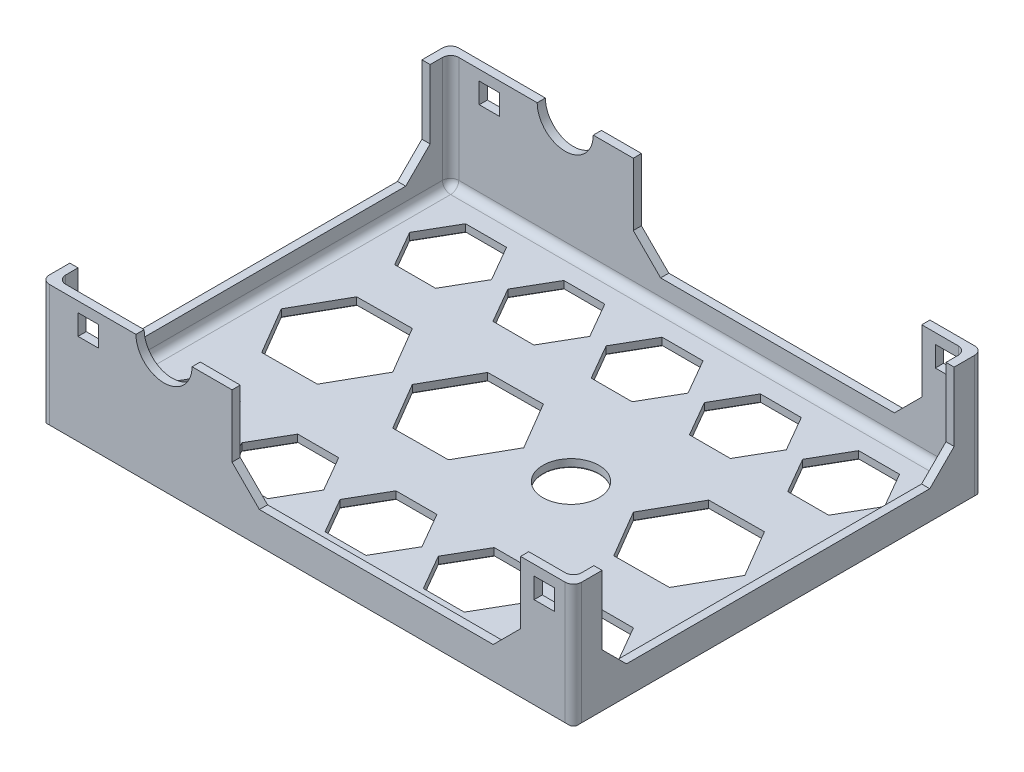
from build123d import *

# Parameters (mm, degrees)
SKETCH1_W            = 130
SKETCH1_H            = 100
BOSS_EXTRUDE1_DEPTH  = 30
SHELL1_T             = -2
CHAMFER1_SIZE        = 0.25
SKETCH2_R            = 6.85
CUT_EXTRUDE1_DEPTH   = 123.983738762
SKETCH3_R            = 6.85
CUT_EXTRUDE2_DEPTH   = 60
CUT_EXTRUDE3_DEPTH   = 123.983738762
CUT_EXTRUDE4_DEPTH   = 143.478068488
CUT_EXTRUDE5_DEPTH   = 87.654486324
LPATTERN1_COUNT      = 5
LPATTERN1_PITCH      = 24
LPATTERN1_COUNT_DIR2 = 2
LPATTERN1_PITCH_DIR2 = 65
CUT_EXTRUDE6_DEPTH   = 87.654486324
LPATTERN2_COUNT      = 2
LPATTERN2_PITCH      = 32
LPATTERN3_COUNT      = 2
LPATTERN3_PITCH      = 86
FILLET1_R            = 2
CHAMFER2_SIZE        = 0.25
FILLET2_R            = 0.25
SKETCH9_W            = 5
SKETCH9_H            = 5
CUT_EXTRUDE7_DEPTH   = 123.983738762
SKETCH10_W           = 5
SKETCH10_H           = 5
CUT_EXTRUDE8_DEPTH   = 123.983738762


with BuildPart() as part:
    # Sketch1 → Boss-Extrude1 (new body)
    with BuildSketch(Plane(origin=(0, 0, 0), x_dir=(1, 0, 0), z_dir=(0, 1, 0))):
        Rectangle(SKETCH1_W, SKETCH1_H)
    extrude(amount=BOSS_EXTRUDE1_DEPTH)

    # Shell1
    shell1_openings = [part.faces().sort_by_distance(p)[0] for p in [
        (0, 30, 0),
    ]]
    offset(amount=SHELL1_T, openings=shell1_openings, kind=Kind.INTERSECTION)

    # Chamfer1
    chamfer1_edges = [part.edges().sort_by_distance(p)[0] for p in [
        (0, 0, 50),
        (-65, 0, 0),
        (0, 0, -50),
        (65, 0, 0),
    ]]
    chamfer(chamfer1_edges, length=CHAMFER1_SIZE)

    # Sketch2 → Cut-Extrude1 (cut, through all)
    with BuildSketch(Plane(origin=(0, 0, -50), x_dir=(-1, 0, 0), z_dir=(0, 0, -1))):
        with Locations((35, 30)):
            Circle(SKETCH2_R)
    extrude(amount=-CUT_EXTRUDE1_DEPTH, mode=Mode.SUBTRACT)

    # Sketch3 → Cut-Extrude2 (cut)
    with BuildSketch(Plane(origin=(0, 2, 0), x_dir=(1, 0, 0), z_dir=(0, 1, 0))):
        with Locations(Location((14.4, 0, 0), (0, 0, 270))):
            Circle(SKETCH3_R)
    extrude(amount=-CUT_EXTRUDE2_DEPTH, mode=Mode.SUBTRACT)

    # Sketch5 → Cut-Extrude3 (cut, through all)
    with BuildSketch(Plane.XY.offset(50)):
        Polygon((52.09, 30), (52.09, 14.7), (45.41, 8.02), (-11.7, 8.02), (-18.38, 14.7), (-18.38, 30), align=None)
    extrude(amount=-CUT_EXTRUDE3_DEPTH, mode=Mode.SUBTRACT)

    # Sketch6 → Cut-Extrude4 (cut, through all)
    with BuildSketch(Plane(origin=(65, 0, 0), x_dir=(0, 0, -1), z_dir=(1, 0, 0))):
        Polygon((-43, 30), (-43, 13.205562602), (-37.044437398, 7.25), (37.044437398, 7.25), (43, 13.205562602), (43, 30), align=None)
    extrude(amount=-CUT_EXTRUDE4_DEPTH, mode=Mode.SUBTRACT)

    # Sketch7 → Cut-Extrude5 (cut, through all)
    with BuildSketch(Plane(origin=(0, 2, 0), x_dir=(1, 0, 0), z_dir=(0, 1, 0))):
        Polygon((-43, 24.339745962), (-38, 33), (-43, 41.660254038), (-53, 41.660254038), (-58, 33), (-53, 24.339745962), align=None)
    cut_extrude5 = extrude(amount=-CUT_EXTRUDE5_DEPTH, mode=Mode.SUBTRACT)

    # LPattern1: Cut-Extrude5 5 × 2
    with Locations(*[(i * LPATTERN1_PITCH, 0, j * LPATTERN1_PITCH_DIR2) for i in range(LPATTERN1_COUNT) for j in range(LPATTERN1_COUNT_DIR2) if (i, j) != (0, 0)]):
        add(cut_extrude5, mode=Mode.SUBTRACT)

    # Sketch8 → Cut-Extrude6 (cut, through all)
    with BuildSketch(Plane(origin=(0, 2, 0), x_dir=(1, 0, 0), z_dir=(0, 1, 0))):
        Polygon((-37.344330278, 13.006181596), (-50.843892889, 12.8975109), (-57.499562611, 1.152211391), (-50.655669722, -10.484417422), (-37.156107111, -10.375746726), (-30.500437389, 1.369552783), align=None)
    cut_extrude6 = extrude(amount=-CUT_EXTRUDE6_DEPTH, mode=Mode.SUBTRACT)

    # LPattern2: Cut-Extrude6 ×2
    with Locations(*[(i * LPATTERN2_PITCH, 0, 0) for i in range(1, LPATTERN2_COUNT)]):
        add(cut_extrude6, mode=Mode.SUBTRACT)

    # LPattern3: Cut-Extrude6 ×2
    with Locations(*[(i * LPATTERN3_PITCH, 0, 0) for i in range(1, LPATTERN3_COUNT)]):
        add(cut_extrude6, mode=Mode.SUBTRACT)

    # Fillet1
    # the kernel refuses this fillet: 2 mm, written as the material it adds along each edge
    with BuildSketch(Plane(origin=(-61, 4, 46), x_dir=(-1, 0, 0), z_dir=(0, -1, 0))) as fillet1_piece_1_section:
        Polygon((0, 0), (FILLET1_R, 0), (FILLET1_R, -FILLET1_R), (0, -FILLET1_R), align=None)
    fillet1_piece_1 = extrude(amount=FILLET1_R, mode=Mode.PRIVATE)
    fillet1_piece_1 = fillet1_piece_1 - Plane(origin=(-61, 4, 46), x_dir=(0.7071067811865475, 0, -0.7071067811865475), z_dir=(0, -1, 0)) * Sphere(FILLET1_R, mode=Mode.PRIVATE)
    add(fillet1_piece_1)
    with BuildSketch(Plane(origin=(61, 4, 46), x_dir=(0, -1, 0), z_dir=(1, 0, 0))) as fillet1_piece_2_section:
        Polygon((0, 0), (FILLET1_R, 0), (FILLET1_R, -FILLET1_R), (0, -FILLET1_R), align=None)
    fillet1_piece_2 = extrude(amount=FILLET1_R, mode=Mode.PRIVATE)
    fillet1_piece_2 = fillet1_piece_2 - Plane(origin=(61, 4, 46), x_dir=(0, 0.7071067811865475, -0.7071067811865475), z_dir=(1, 0, 0)) * Sphere(FILLET1_R, mode=Mode.PRIVATE)
    add(fillet1_piece_2)
    with BuildSketch(Plane(origin=(61, 4, -46), x_dir=(0, -1, 0), z_dir=(1, 0, 0))) as fillet1_piece_3_section:
        Polygon((0, 0), (FILLET1_R, 0), (FILLET1_R, FILLET1_R), (0, FILLET1_R), align=None)
    fillet1_piece_3 = extrude(amount=FILLET1_R, mode=Mode.PRIVATE)
    fillet1_piece_3 = fillet1_piece_3 - Plane(origin=(61, 4, -46), x_dir=(0, 0.7071067811865475, 0.7071067811865475), z_dir=(1, 0, 0)) * Sphere(FILLET1_R, mode=Mode.PRIVATE)
    add(fillet1_piece_3)
    with BuildSketch(Plane(origin=(-61, 4, -46), x_dir=(-1, 0, 0), z_dir=(0, -1, 0))) as fillet1_piece_4_section:
        Polygon((0, 0), (FILLET1_R, 0), (FILLET1_R, FILLET1_R), (0, FILLET1_R), align=None)
    fillet1_piece_4 = extrude(amount=FILLET1_R, mode=Mode.PRIVATE)
    fillet1_piece_4 = fillet1_piece_4 - Plane(origin=(-61, 4, -46), x_dir=(0.7071067811865475, 0, 0.7071067811865475), z_dir=(0, -1, 0)) * Sphere(FILLET1_R, mode=Mode.PRIVATE)
    add(fillet1_piece_4)
    with BuildSketch(Plane(origin=(-63, 30, 48), x_dir=(1, 0, 0), z_dir=(0, -1, 0)), Plane(origin=(63, 4, 48), x_dir=(-1, 0, 0), z_dir=(0, 1, 0)), Plane(origin=(63, 4, -48), x_dir=(0, 0, 1), z_dir=(0, 1, 0))) as fillet1_piece_5:
        with BuildLine():
            CenterArc((FILLET1_R, -FILLET1_R), FILLET1_R, 90, 90)
            Line((0, -FILLET1_R), (0, 0))
            Line((0, 0), (FILLET1_R, 0))
        make_face()
    extrude(amount=26)
    with BuildSketch(Plane(origin=(-63, 4, -48), x_dir=(0, 0, 1), z_dir=(0, 1, 0))) as fillet1_piece_6:
        with BuildLine():
            CenterArc((FILLET1_R, FILLET1_R), FILLET1_R, 180, 90)
            Line((0, FILLET1_R), (0, 0))
            Line((0, 0), (FILLET1_R, 0))
        make_face()
    extrude(amount=26)
    with BuildSketch(Plane(origin=(-61, 2, 48), x_dir=(0, 1, 0), z_dir=(1, 0, 0)), Plane(origin=(61, 2, -48), x_dir=(0, 1, 0), z_dir=(-1, 0, 0))) as fillet1_piece_7:
        with BuildLine():
            CenterArc((FILLET1_R, -FILLET1_R), FILLET1_R, 90, 90)
            Line((0, -FILLET1_R), (0, 0))
            Line((0, 0), (FILLET1_R, 0))
        make_face()
    extrude(amount=122)
    with BuildSketch(Plane(origin=(-63, 2, -46), x_dir=(0, 1, 0), z_dir=(0, 0, 1)), Plane(origin=(63, 2, 46), x_dir=(0, 1, 0), z_dir=(0, 0, -1))) as fillet1_piece_8:
        with BuildLine():
            CenterArc((FILLET1_R, -FILLET1_R), FILLET1_R, 90, 90)
            Line((0, -FILLET1_R), (0, 0))
            Line((0, 0), (FILLET1_R, 0))
        make_face()
    extrude(amount=92)
    # the kernel refuses this fillet: 2 mm, written as the material it takes off along each edge
    with BuildSketch(Plane(origin=(-65, -4.75, -50), x_dir=(0, 0, 1), z_dir=(0, 1, 0)), Plane(origin=(-65, -4.75, 50), x_dir=(1, 0, 0), z_dir=(0, 1, 0))) as fillet1_2_piece_1:
        with BuildLine():
            CenterArc((FILLET1_R, FILLET1_R), FILLET1_R, 180, 90)
            Line((0, FILLET1_R), (0, 0))
            Line((0, 0), (FILLET1_R, 0))
        make_face()
    extrude(amount=39.75, mode=Mode.SUBTRACT)
    with BuildSketch(Plane(origin=(65, -4.75, -50), x_dir=(0, 0, 1), z_dir=(0, 1, 0)), Plane(origin=(65, -4.75, 50), x_dir=(-1, 0, 0), z_dir=(0, 1, 0))) as fillet1_2_piece_2:
        with BuildLine():
            CenterArc((FILLET1_R, -FILLET1_R), FILLET1_R, 90, 90)
            Line((0, -FILLET1_R), (0, 0))
            Line((0, 0), (FILLET1_R, 0))
        make_face()
    extrude(amount=39.75, mode=Mode.SUBTRACT)

    # Chamfer2
    chamfer2_edges = [part.edges().sort_by_distance(p)[0] for p in [
        (-48, 0, -24.339745962),
        (-55.5, 0, -28.669872981),
        (-55.5, 0, -37.330127019),
        (-48, 0, -41.660254038),
        (-40.5, 0, -37.330127019),
        (-40.5, 0, -28.669872981),
        (-24, 0, -24.339745962),
        (-31.5, 0, -28.669872981),
        (-31.5, 0, -37.330127019),
        (-24, 0, -41.660254038),
        (-16.5, 0, -37.330127019),
        (-16.5, 0, -28.669872981),
        (0, 0, -24.339745962),
        (7.5, 0, -28.669872981),
        (7.5, 0, -37.330127019),
        (0, 0, -41.660254038),
        (-7.5, 0, -37.330127019),
        (-7.5, 0, -28.669872981),
        (24, 0, -24.339745962),
        (31.5, 0, -28.669872981),
        (31.5, 0, -37.330127019),
        (24, 0, -41.660254038),
        (16.5, 0, -37.330127019),
        (16.5, 0, -28.669872981),
        (48, 0, -24.339745962),
        (55.5, 0, -28.669872981),
        (55.5, 0, -37.330127019),
        (48, 0, -41.660254038),
        (40.5, 0, -37.330127019),
        (40.5, 0, -28.669872981),
        (-48, 0, 40.660254038),
        (-40.5, 0, 36.330127019),
        (-40.5, 0, 27.669872981),
        (-48, 0, 23.339745962),
        (-55.5, 0, 27.669872981),
        (-55.5, 0, 36.330127019),
        (-24, 0, 40.660254038),
        (-16.5, 0, 36.330127019),
        (-16.5, 0, 27.669872981),
        (-24, 0, 23.339745962),
        (-31.5, 0, 27.669872981),
        (-31.5, 0, 36.330127019),
        (0, 0, 40.660254038),
        (7.5, 0, 36.330127019),
        (7.5, 0, 27.669872981),
        (0, 0, 23.339745962),
        (-7.5, 0, 27.669872981),
        (-7.5, 0, 36.330127019),
        (24, 0, 40.660254038),
        (31.5, 0, 36.330127019),
        (31.5, 0, 27.669872981),
        (24, 0, 23.339745962),
        (16.5, 0, 27.669872981),
        (16.5, 0, 36.330127019),
        (48, 0, 40.660254038),
        (55.5, 0, 36.330127019),
        (55.5, 0, 27.669872981),
        (48, 0, 23.339745962),
        (40.5, 0, 27.669872981),
        (40.5, 0, 36.330127019),
        (-33.922383834, 0, -7.18786719),
        (-33.82827225, 0, 4.503096971),
        (-43.905888416, 0, 10.430082074),
        (-54.077616166, 0, 4.666103015),
        (-54.17172775, 0, -7.024861145),
        (-44.094111584, 0, -12.951846248),
        (-1.922383834, 0, -7.18786719),
        (-1.82827225, 0, 4.503096971),
        (-11.905888416, 0, 10.430082074),
        (-22.077616166, 0, 4.666103015),
        (-22.17172775, 0, -7.024861145),
        (-12.094111584, 0, -12.951846248),
        (52.077616166, 0, -7.18786719),
        (52.17172775, 0, 4.503096971),
        (42.094111584, 0, 10.430082074),
        (31.922383834, 0, 4.666103015),
        (31.82827225, 0, -7.024861145),
        (41.905888416, 0, -12.951846248),
    ]]
    chamfer(chamfer2_edges, length=CHAMFER2_SIZE)

    # Fillet2
    fillet2_edges = [part.edges().sort_by_distance(p)[0] for p in [
        (14.4, 0, -6.85),
    ]]
    fillet(fillet2_edges, radius=FILLET2_R)

    # Sketch9 → Cut-Extrude7 (cut, through all)
    with BuildSketch(Plane.XY.offset(50)):
        with Locations((-53.5, 25)):
            Rectangle(SKETCH9_W, SKETCH9_H)
    extrude(amount=-CUT_EXTRUDE7_DEPTH, mode=Mode.SUBTRACT)

    # Sketch10 → Cut-Extrude8 (cut, through all)
    with BuildSketch(Plane.XY.offset(50)):
        with Locations((57.9, 25)):
            Rectangle(SKETCH10_W, SKETCH10_H)
    extrude(amount=-CUT_EXTRUDE8_DEPTH, mode=Mode.SUBTRACT)


solid = part.part
